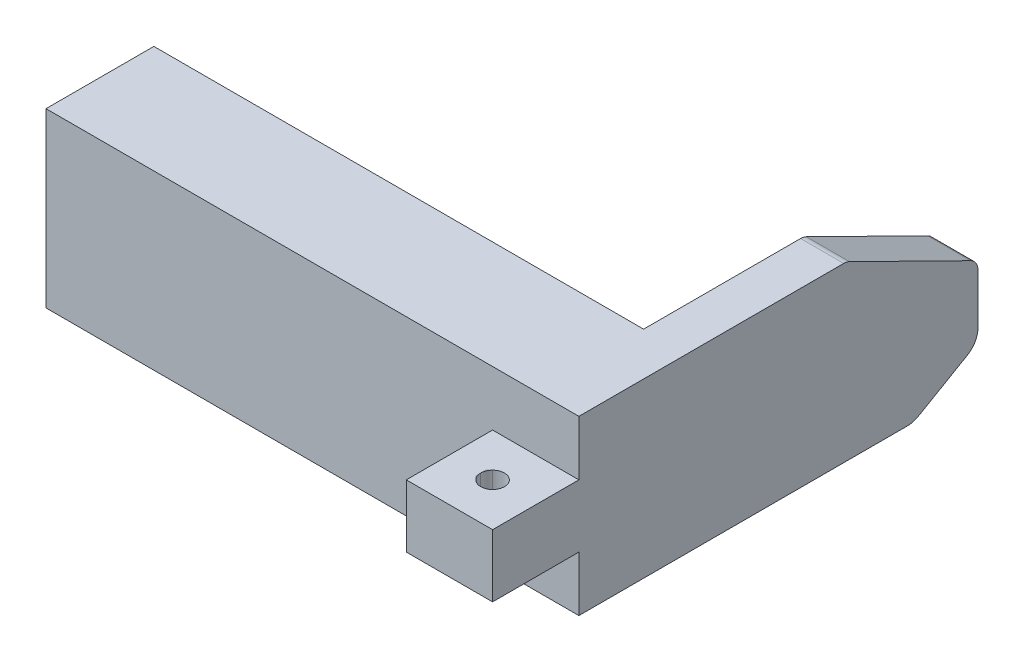
from build123d import *

# Parameters (mm, degrees)
SKETCH1_W            = 92.5
SKETCH1_H            = 40
BOSS_EXTRUDE1_DEPTH  = 10
SKETCH5_R            = 5.5
CUT_EXTRUDE1_DEPTH   = 8.5
SKETCH4_W            = 25
SKETCH4_H            = 40
SKETCH4_W_2          = 10.25
SKETCH4_H_2          = 25.25
BOSS_EXTRUDE7_DEPTH  = 113.5
FILLET1_R            = 3
CHAMFER1_SIZE        = 15
CHAMFER1_SIZE2       = 30.41699103
FILLET3_R            = 3
CHAMFER3_SIZE        = 15
CHAMFER3_SIZE2       = 8.660254038
FILLET7_R            = 5
SKETCH7_W            = 20
SKETCH7_H            = 14.5
BOSS_EXTRUDE8_DEPTH  = 20
M5_CLEARANCE_HOLE1_D = 5.5
SPLIT1_START         = -7.120426829
SPLIT1_DEPTH         = 14.5
SPLIT1_2_DEPTH       = 14.5
SPLIT1_3_DEPTH       = 14.5


# Read off the part's stored shape, not the designer's step: Split1
with BuildPart() as part:
    # Sketch1 → Boss-Extrude1 (new body)
    with BuildSketch(Plane(origin=(0, 0, 0), x_dir=(0, 0, -1), z_dir=(1, 0, 0))):
        with Locations((10.335365854, 0.129573171)):
            Rectangle(SKETCH1_W, SKETCH1_H)
    extrude(amount=BOSS_EXTRUDE1_DEPTH)

    # Sketch5 → Cut-Extrude1 (cut)
    with BuildSketch(Plane.ZY):
        with Locations((-35.585365854, 0.129573171)):
            Circle(SKETCH5_R)
    extrude(amount=-CUT_EXTRUDE1_DEPTH, mode=Mode.SUBTRACT)

    # Sketch4 → Boss-Extrude7 (add)
    with BuildSketch(Plane.ZY):
        with Locations((23.414634146, 0.129573171)):
            Rectangle(SKETCH4_W, SKETCH4_H)
        with Locations((23.414634146, 0.129573171)):
            Rectangle(SKETCH4_W_2, SKETCH4_H_2, mode=Mode.SUBTRACT)
    extrude(amount=BOSS_EXTRUDE7_DEPTH)

    # Fillet1
    fillet1_edges = [part.edges().sort_by_distance(p)[0] for p in [
        (-113.5, 12.754573171, 23.414634146),
        (-113.5, 0.129573171, 18.289634146),
        (-113.5, -12.495426829, 23.414634146),
        (-113.5, 0.129573171, 28.539634146),
    ]]
    fillet(fillet1_edges, radius=FILLET1_R)

    # Chamfer1
    chamfer1_edges = [part.edges().sort_by_distance(p)[0] for p in [
        (5, 20.129573171, -56.585365854),
    ]]
    chamfer1_side = [part.faces().sort_by_distance(p)[0] for p in [
        (5, 0.129573171, -56.585365854),
    ]]
    chamfer(chamfer1_edges, length=CHAMFER1_SIZE, length2=CHAMFER1_SIZE2, reference=chamfer1_side[0])

    # Fillet3
    fillet3_edges = [part.edges().sort_by_distance(p)[0] for p in [
        (5, 20.129573171, -26.168374824),
        (5, 5.129573171, -56.585365854),
    ]]
    fillet(fillet3_edges, radius=FILLET3_R)

    # Chamfer3
    chamfer3_edges = [part.edges().sort_by_distance(p)[0] for p in [
        (5, -19.870426829, -56.585365854),
    ]]
    chamfer3_side = [part.faces().sort_by_distance(p)[0] for p in [
        (-41.568936877, -19.870426829, 15.117291954),
    ]]
    chamfer(chamfer3_edges, length=CHAMFER3_SIZE, length2=CHAMFER3_SIZE2, reference=chamfer3_side[0])

    # Fillet7
    fillet7_edges = [part.edges().sort_by_distance(p)[0] for p in [
        (5, -11.210172791, -56.585365854),
        (5, -19.870426829, -41.585365854),
    ]]
    fillet(fillet7_edges, radius=FILLET7_R)

    # Sketch7 → Boss-Extrude8 (add)
    with BuildSketch(Plane(origin=(10, 20.129573171, 35.914634146), x_dir=(1, 0, 0), z_dir=(0, 0, 1))):
        with Locations((-10, -20)):
            Rectangle(SKETCH7_W, SKETCH7_H)
    extrude(amount=BOSS_EXTRUDE8_DEPTH)

    # M5 Clearance Hole1 (through all)
    with Locations(Plane(origin=(0, 7.379573171, 0), x_dir=(1, 0, 0), z_dir=(0, 1, 0))):
        with Locations((0, -45.914634146)):
            Hole(M5_CLEARANCE_HOLE1_D / 2)

    # Split1 outline → Split1 (cut)
    with BuildSketch(Plane(origin=(0, 0, 0), x_dir=(1, 0, 0), z_dir=(0, 1, 0)).offset(SPLIT1_START)):
        with BuildLine():
            Line((-2.75, -45.914634146), (-2.75, -47.053721443))
            Line((-2.75, -47.053721443), (-1.944543648, -47.859177795))
            ThreePointArc((-1.944543648, -47.859177795), (-2.540668714, -46.967013585), (-2.75, -45.914634146))
        make_face()
        with BuildLine():
            Line((-2.75, -44.77554685), (-2.75, -45.914634146))
            ThreePointArc((-2.75, -45.914634146), (-2.540668714, -44.862254707), (-1.944543648, -43.970090498))
            Line((-1.944543648, -43.970090498), (-2.75, -44.77554685))
        make_face()
    extrude(amount=SPLIT1_DEPTH, mode=Mode.SUBTRACT)


with BuildPart() as body_2:
    # Split1 2 outline → Split1 2 (new body)
    with BuildSketch(Plane(origin=(0, 0, 0), x_dir=(1, 0, 0), z_dir=(0, 1, 0)).offset(SPLIT1_START)):
        with BuildLine():
            Line((-2.75, -45.914634146), (-2.75, -47.053721443))
            Line((-2.75, -47.053721443), (-1.944543648, -47.859177795))
            ThreePointArc((-1.944543648, -47.859177795), (-2.540668714, -46.967013585), (-2.75, -45.914634146))
        make_face()
    extrude(amount=SPLIT1_2_DEPTH)


with BuildPart() as body_3:
    # Split1 3 outline → Split1 3 (new body)
    with BuildSketch(Plane(origin=(0, 0, 0), x_dir=(1, 0, 0), z_dir=(0, 1, 0)).offset(SPLIT1_START)):
        with BuildLine():
            Line((-1.944543648, -43.970090498), (-2.75, -44.77554685))
            Line((-2.75, -44.77554685), (-2.75, -45.914634146))
            ThreePointArc((-2.75, -45.914634146), (-2.540668714, -44.862254707), (-1.944543648, -43.970090498))
        make_face()
    extrude(amount=SPLIT1_3_DEPTH)


solid = Compound([part.part, body_2.part, body_3.part])
